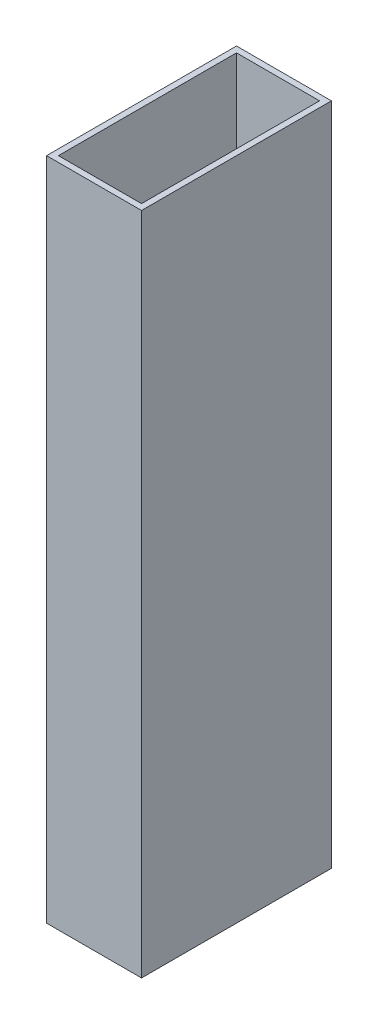
from build123d import *

# Parameters (mm, degrees)
SKETCH1_W           = 25.4
SKETCH1_H           = 50.8
SKETCH1_W_2         = 22.225
SKETCH1_H_2         = 47.625
EXTRUDE_THIN1_DEPTH = 177.8


with BuildPart() as part:
    # Sketch1 → Extrude-Thin1 (new body)
    with BuildSketch(Plane(origin=(0, 0, 0), x_dir=(1, 0, 0), z_dir=(0, 1, 0))):
        Rectangle(SKETCH1_W, SKETCH1_H)
        Rectangle(SKETCH1_W_2, SKETCH1_H_2, mode=Mode.SUBTRACT)
    extrude(amount=EXTRUDE_THIN1_DEPTH)


solid = part.part
